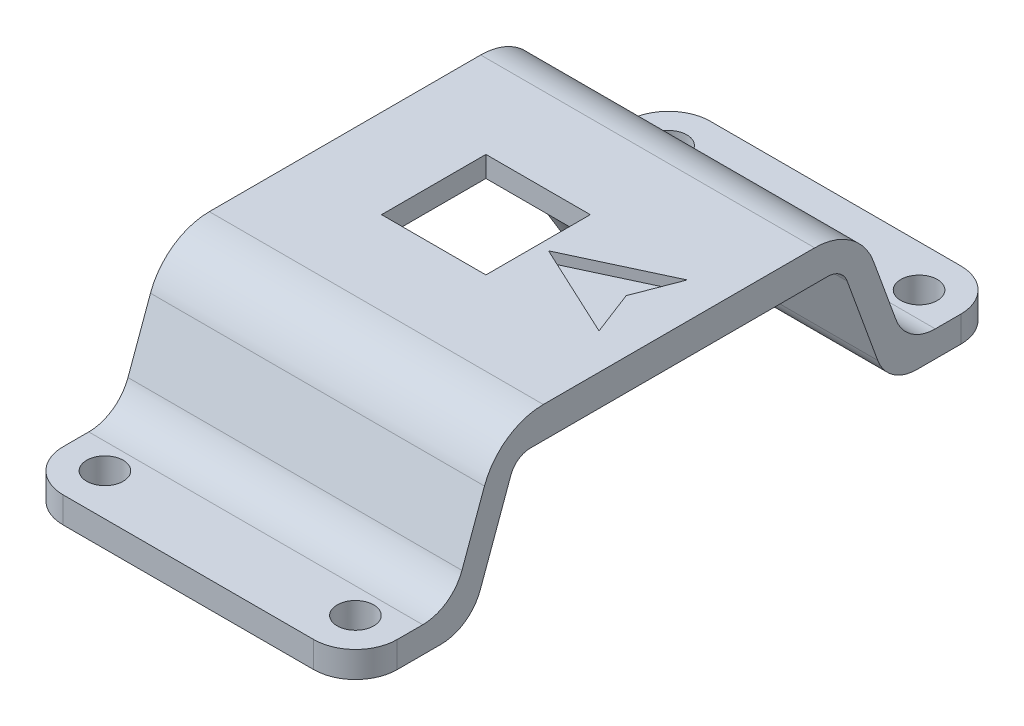
from build123d import *

# Parameters (mm, degrees)
EXTRUDE_1_DEPTH                      = 32
SKETCH_2_R                           = 1.75
CUT_EXTRUDE_1_DEPTH                  = 48.010637094
PATTERN_LINEAR_1_COUNT               = 2
PATTERN_LINEAR_1_PITCH               = 24
PATTERN_LINEAR_1_COUNT_DIR2          = 2
PATTERN_LINEAR_1_PITCH_DIR2          = 54
FILLET_1_R                           = 4
FILLET_3_R                           = 6
FILLET_5_R                           = 4
SKETCH_4_W                           = 10
SKETCH_4_H                           = 10
CUT_EXTRUDE_3_DEPTH                  = 48.010637094
FILLET_6_R                           = 2
SKETCH_3_R                           = 2.5
SKETCH_3_R_2                         = 1
EXTRUDE_3_DEPTH                      = 3
CHAMFER_3_SIZE                       = 1.75
CHAMFER_3_SIZE_2                     = 3.031088913
PATTERN_LINEAR_5_COUNT               = 2
PATTERN_LINEAR_5_PITCH               = 12.5
PATTERN_LINEAR_5_COUNT_DIR2          = 2
PATTERN_LINEAR_5_PITCH_DIR2          = 21
CHAMFER_3_OF_PATTERN_LINEAR_5_SIZE   = 1.75
CHAMFER_3_OF_PATTERN_LINEAR_5_SIZE_2 = 3.031088913
CUT_EXTRUDE_5_DEPTH                  = 1
CHAMFER_4_SIZE                       = 1


with BuildPart() as part:
    # Эскиз1 → Бобышка-Вытянуть1 (new body)
    with BuildSketch(Plane(origin=(0, 0, 0), x_dir=(0, 0, -1), z_dir=(1, 0, 0))):
        Polygon((-31, 0), (-20, 0), (-15.632357189, 12), (15.632357189, 12), (20, 0), (31, 0), (31, 2.5), (21.750518846, 2.5), (17.200890917, 15), (-17.200890917, 15), (-21.750518846, 2.5), (-31, 2.5), align=None)
    extrude(amount=EXTRUDE_1_DEPTH)

    # Эскиз2 → Вырез-Вытянуть1 (cut, through all)
    with BuildSketch(Plane.XZ):
        with Locations(Location((4, 27, 0), (0, 0, 270))):
            Circle(SKETCH_2_R)
    cut_extrude_1 = extrude(amount=-CUT_EXTRUDE_1_DEPTH, mode=Mode.SUBTRACT)

    # Линейный массив1: Cut-Extrude 1 2 × 2
    with Locations(*[(i * PATTERN_LINEAR_1_PITCH, 0, -j * PATTERN_LINEAR_1_PITCH_DIR2) for i in range(PATTERN_LINEAR_1_COUNT) for j in range(PATTERN_LINEAR_1_COUNT_DIR2) if (i, j) != (0, 0)]):
        add(cut_extrude_1, mode=Mode.SUBTRACT)

    # Скругление1
    fillet_1_edges = [part.edges().sort_by_distance(p)[0] for p in [
        (0, 1.25, -31),
        (0, 1.25, 31),
        (32, 1.25, -31),
        (32, 1.25, 31),
    ]]
    fillet(fillet_1_edges, radius=FILLET_1_R)

    # Скругление3
    fillet_3_edges = [part.edges().sort_by_distance(p)[0] for p in [
        (16, 15, 17.200890917),
        (16, 15, -17.200890917),
    ]]
    fillet(fillet_3_edges, radius=FILLET_3_R)

    # Скругление5
    fillet_5_edges = [part.edges().sort_by_distance(p)[0] for p in [
        (16, 2.5, 21.750518846),
        (16, 2.5, -21.750518846),
        (16, 0, -20),
        (16, 0, 20),
    ]]
    fillet(fillet_5_edges, radius=FILLET_5_R)

    # Эскиз4 → Вырез-Вытянуть3 (cut, through all)
    with BuildSketch(Plane(origin=(0, 15, 0), x_dir=(1, 0, 0), z_dir=(0, 1, 0))):
        with Locations((13.5, 0)):
            Rectangle(SKETCH_4_W, SKETCH_4_H)
    extrude(amount=-CUT_EXTRUDE_3_DEPTH, mode=Mode.SUBTRACT)

    # Скругление6
    fillet_6_edges = [part.edges().sort_by_distance(p)[0] for p in [
        (16, 12, -15.632357189),
        (16, 12, 15.632357189),
    ]]
    fillet(fillet_6_edges, radius=FILLET_6_R)

    # Эскиз3 → Бобышка-Вытянуть3 (add)
    with BuildSketch(Plane.XZ.offset(-12)):
        with Locations(Location((26, 10.5, 0), (0, 0, 90))):
            Circle(SKETCH_3_R)
        with Locations(Location((26, 10.5, 0), (0, 0, 270))):
            Circle(SKETCH_3_R_2, mode=Mode.SUBTRACT)
    extrude_3 = extrude(amount=EXTRUDE_3_DEPTH)

    # Фаска3
    # the kernel refuses this chamfer: 3.031088913, 1.75 mm, written as the material it adds along each edge
    with BuildSketch(Plane(origin=(26, 12, 10.5), x_dir=(0, 0, 1), z_dir=(1, 0, 0))) as chamfer_3_piece_1_section:
        Polygon((2.5 + CHAMFER_3_SIZE, 0), (2.5, CHAMFER_3_SIZE_2), (2.5, 0), align=None)
    chamfer_3_piece_1 = revolve(axis=Axis((26, 12, 10.5), (0, -1, 0)), mode=Mode.PRIVATE)
    chamfer_3_piece_1 = split(chamfer_3_piece_1, bisect_by=Plane(origin=(26, 9, 7.119181545), z_dir=(0, 1, 0)), keep=Keep.TOP, mode=Mode.PRIVATE)
    add(chamfer_3_piece_1)

    # Линейный массив5: Extrude 3 2 × 2
    with Locations(*[(-i * PATTERN_LINEAR_5_PITCH, 0, -j * PATTERN_LINEAR_5_PITCH_DIR2) for i in range(PATTERN_LINEAR_5_COUNT) for j in range(PATTERN_LINEAR_5_COUNT_DIR2) if (i, j) != (0, 0)]):
        add(extrude_3)

    # Фаска3 of Линейный массив5
    # the kernel refuses this chamfer: 3.031088913, 1.75 mm, written as the material it adds along each edge
    with BuildSketch(Plane(origin=(26, 12, -10.5), x_dir=(0, 0, 1), z_dir=(1, 0, 0))) as chamfer_3_of_pattern_linear_5_piece_1_section:
        Polygon((2.5 + CHAMFER_3_OF_PATTERN_LINEAR_5_SIZE, 0), (2.5, CHAMFER_3_OF_PATTERN_LINEAR_5_SIZE_2), (2.5, 0), align=None)
    chamfer_3_of_pattern_linear_5_piece_1 = revolve(axis=Axis((26, 12, -10.5), (0, -1, 0)), mode=Mode.PRIVATE)
    chamfer_3_of_pattern_linear_5_piece_1 = split(chamfer_3_of_pattern_linear_5_piece_1, bisect_by=Plane(origin=(26, 9, -13.880818454), z_dir=(0, 1, 0)), keep=Keep.TOP, mode=Mode.PRIVATE)
    add(chamfer_3_of_pattern_linear_5_piece_1)
    with BuildSketch(Plane(origin=(13.5, 12, 10.5), x_dir=(0, 0, 1), z_dir=(1, 0, 0))) as chamfer_3_of_pattern_linear_5_piece_2_section:
        Polygon((2.5 + CHAMFER_3_OF_PATTERN_LINEAR_5_SIZE, 0), (2.5, CHAMFER_3_OF_PATTERN_LINEAR_5_SIZE_2), (2.5, 0), align=None)
    chamfer_3_of_pattern_linear_5_piece_2 = revolve(axis=Axis((13.5, 12, 10.5), (0, -1, 0)), mode=Mode.PRIVATE)
    chamfer_3_of_pattern_linear_5_piece_2 = split(chamfer_3_of_pattern_linear_5_piece_2, bisect_by=Plane(origin=(13.5, 9, 7.119181545), z_dir=(0, 1, 0)), keep=Keep.TOP, mode=Mode.PRIVATE)
    add(chamfer_3_of_pattern_linear_5_piece_2)
    with BuildSketch(Plane(origin=(13.5, 12, -10.5), x_dir=(0, 0, 1), z_dir=(1, 0, 0))) as chamfer_3_of_pattern_linear_5_piece_3_section:
        Polygon((2.5 + CHAMFER_3_OF_PATTERN_LINEAR_5_SIZE, 0), (2.5, CHAMFER_3_OF_PATTERN_LINEAR_5_SIZE_2), (2.5, 0), align=None)
    chamfer_3_of_pattern_linear_5_piece_3 = revolve(axis=Axis((13.5, 12, -10.5), (0, -1, 0)), mode=Mode.PRIVATE)
    chamfer_3_of_pattern_linear_5_piece_3 = split(chamfer_3_of_pattern_linear_5_piece_3, bisect_by=Plane(origin=(13.5, 9, -13.880818454), z_dir=(0, 1, 0)), keep=Keep.TOP, mode=Mode.PRIVATE)
    add(chamfer_3_of_pattern_linear_5_piece_3)

    # Эскиз12 → Вырез-Вытянуть5 (cut)
    with BuildSketch(Plane(origin=(0, 15, 0), x_dir=(1, 0, 0), z_dir=(0, 1, 0))):
        Polygon((19.5, 0), (28.56307787, -4.226182617), (26.940798358, 0), (28.56307787, 4.226182617), align=None)
    extrude(amount=-CUT_EXTRUDE_5_DEPTH, mode=Mode.SUBTRACT)

    # Фаска4
    chamfer_4_edges = [part.edges().sort_by_distance(p)[0] for p in [
        (13.5, 12, 5),
        (8.5, 12, 0),
        (13.5, 12, -5),
        (18.5, 12, 0),
    ]]
    chamfer(chamfer_4_edges, length=CHAMFER_4_SIZE)


solid = part.part
